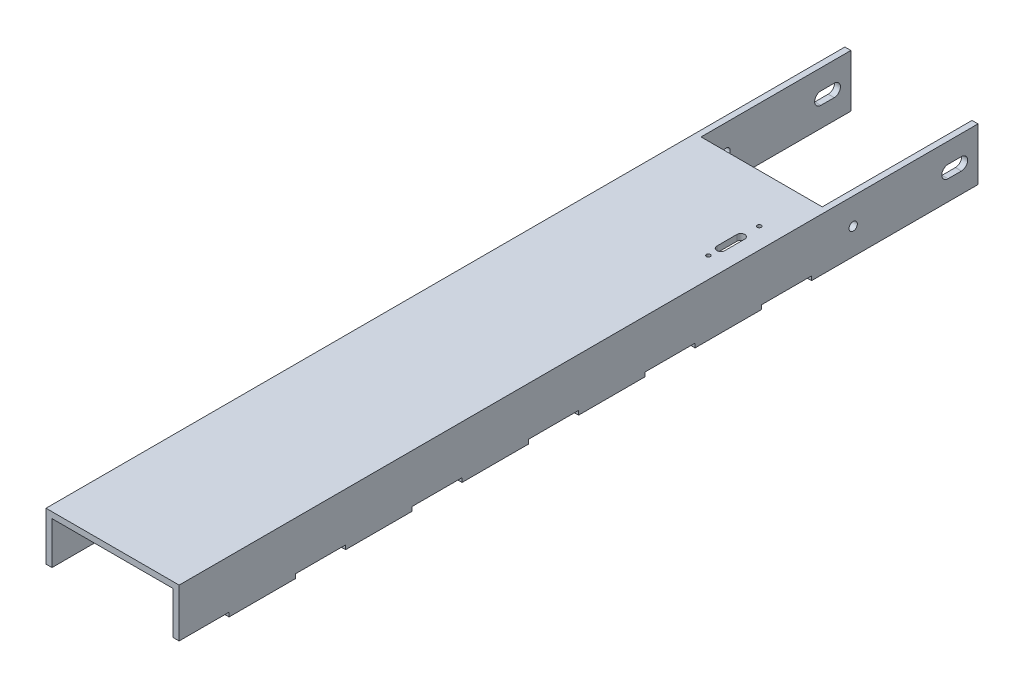
from build123d import *

# Parameters (mm, degrees)
BOSS_EXTRUDE1_DEPTH = 609.6
SKETCH3_R           = 1.524
SKETCH3_W           = 92.456
SKETCH3_H           = 114.3
CUT_EXTRUDE1_DEPTH  = 614.028039672
SKETCH4_R           = 3.175
SKETCH4_W           = 38.1
SKETCH4_H           = 3.175
CUT_EXTRUDE2_DEPTH  = 620.310340156


with BuildPart() as part:
    # Sketch1 → Boss-Extrude1 (new body)
    with BuildSketch(Plane.XY):
        Polygon((-50.8, 0), (50.8, 0), (50.8, -40.132), (46.228, -40.132), (46.228, -4.572), (-46.228, -4.572), (-46.228, -40.132), (-50.8, -40.132), align=None)
    extrude(amount=BOSS_EXTRUDE1_DEPTH)

    # Sketch3 → Cut-Extrude1 (cut, through all)
    with BuildSketch(Plane(origin=(0, 0, 0), x_dir=(1, 0, 0), z_dir=(0, 1, 0))):
        with Locations((34.925, -151.13)):
            Circle(SKETCH3_R)
        with Locations((34.925, -189.865)):
            Circle(SKETCH3_R)
        with Locations((0, -57.15)):
            Rectangle(SKETCH3_W, SKETCH3_H)
        with BuildLine():
            Line((37.973, -165.1), (37.973, -180.34))
            ThreePointArc((37.973, -180.34), (34.925, -183.388), (31.877, -180.34))
            Line((31.877, -180.34), (31.877, -165.1))
            ThreePointArc((31.877, -165.1), (34.925, -162.052), (37.973, -165.1))
        make_face()
    extrude(amount=-CUT_EXTRUDE1_DEPTH, mode=Mode.SUBTRACT)

    # Sketch4 → Cut-Extrude2 (cut, through all)
    with BuildSketch(Plane(origin=(50.8, 0, 0), x_dir=(0, 0, -1), z_dir=(1, 0, 0))):
        with Locations((-95.25, -20.066)):
            Circle(SKETCH4_R)
        with BuildLine():
            Line((-12.7, -24.8285), (-22.86, -24.8285))
            ThreePointArc((-22.86, -24.8285), (-27.6225, -20.066), (-22.86, -15.3035))
            Line((-22.86, -15.3035), (-12.7, -15.3035))
            ThreePointArc((-12.7, -15.3035), (-7.9375, -20.066), (-12.7, -24.8285))
        make_face()
        with Locations((-501.65, -38.5445)):
            Rectangle(SKETCH4_W, SKETCH4_H)
        with Locations((-590.55, -38.5445)):
            Rectangle(SKETCH4_W, SKETCH4_H)
        with Locations((-412.75, -38.5445)):
            Rectangle(SKETCH4_W, SKETCH4_H)
        with Locations((-323.85, -38.5445)):
            Rectangle(SKETCH4_W, SKETCH4_H)
        with Locations((-234.95, -38.5445)):
            Rectangle(SKETCH4_W, SKETCH4_H)
        with Locations((-146.05, -38.5445)):
            Rectangle(SKETCH4_W, SKETCH4_H)
    extrude(amount=-CUT_EXTRUDE2_DEPTH, mode=Mode.SUBTRACT)


solid = part.part
